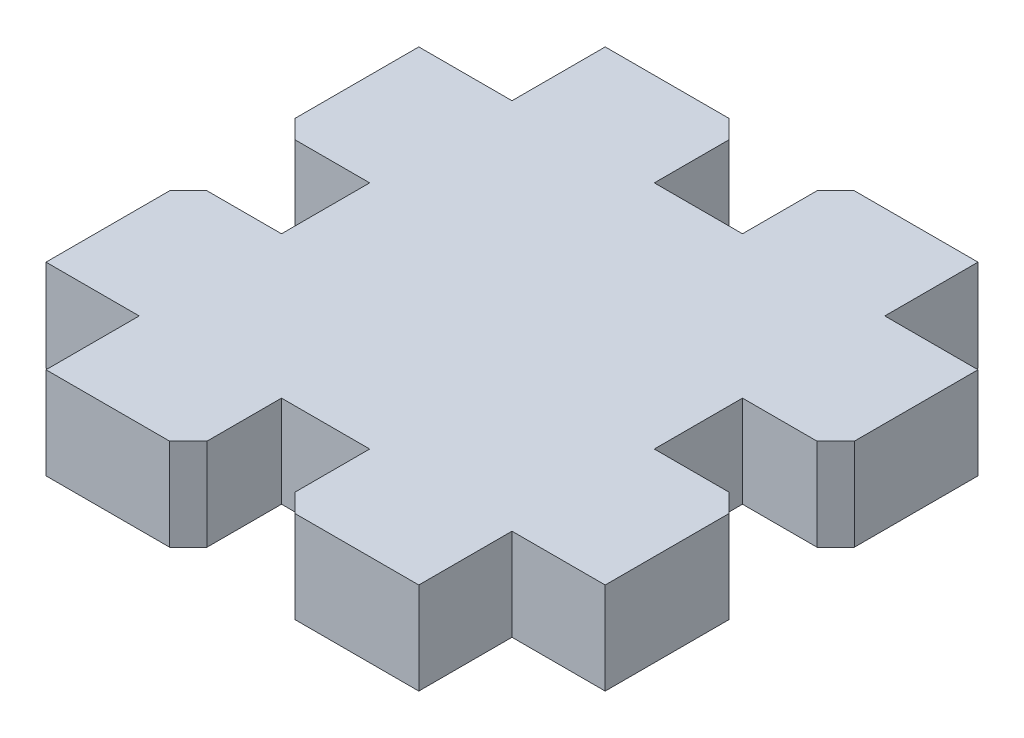
from build123d import *

# Parameters (mm, degrees)
BOSS_EXTRUDE1_DEPTH = 6.2611
CHAMFER1_SIZE       = 1.27


with BuildPart() as part:
    # Sketch1 → Boss-Extrude1 (new body)
    with BuildSketch(Plane(origin=(0, 0, 0), x_dir=(1, 0, 0), z_dir=(0, 1, 0))):
        Polygon((-3.00355, -11.264562061), (-3.00355, -4.914562061), (3.00355, -4.914562061), (3.00355, -11.264562061), (12.7, -11.264562061), (12.7, -4.914562061), (19.05, -4.914562061), (19.05, 4.781887939), (12.7, 4.781887939), (12.7, 10.788987939), (19.05, 10.788987939), (19.05, 20.485437939), (12.7, 20.485437939), (12.7, 26.835437939), (3.00355, 26.835437939), (3.00355, 20.485437939), (-3.00355, 20.485437939), (-3.00355, 26.835437939), (-12.7, 26.835437939), (-12.7, 20.485437939), (-19.05, 20.485437939), (-19.05, 10.788987939), (-12.7, 10.788987939), (-12.7, 4.781887939), (-19.05, 4.781887939), (-19.05, -4.914562061), (-12.7, -4.914562061), (-12.7, -11.264562061), align=None)
    extrude(amount=BOSS_EXTRUDE1_DEPTH)

    # Chamfer1
    chamfer1_edges = [part.edges().sort_by_distance(p)[0] for p in [
        (3.00355, 3.13055, -26.835437939),
        (-3.00355, 3.13055, -26.835437939),
        (19.05, 3.13055, -10.788987939),
        (19.05, 3.13055, -4.781887939),
        (3.00355, 3.13055, 11.264562061),
        (-3.00355, 3.13055, 11.264562061),
        (-19.05, 3.13055, -4.781887939),
        (-19.05, 3.13055, -10.788987939),
    ]]
    chamfer(chamfer1_edges, length=CHAMFER1_SIZE)


solid = part.part
